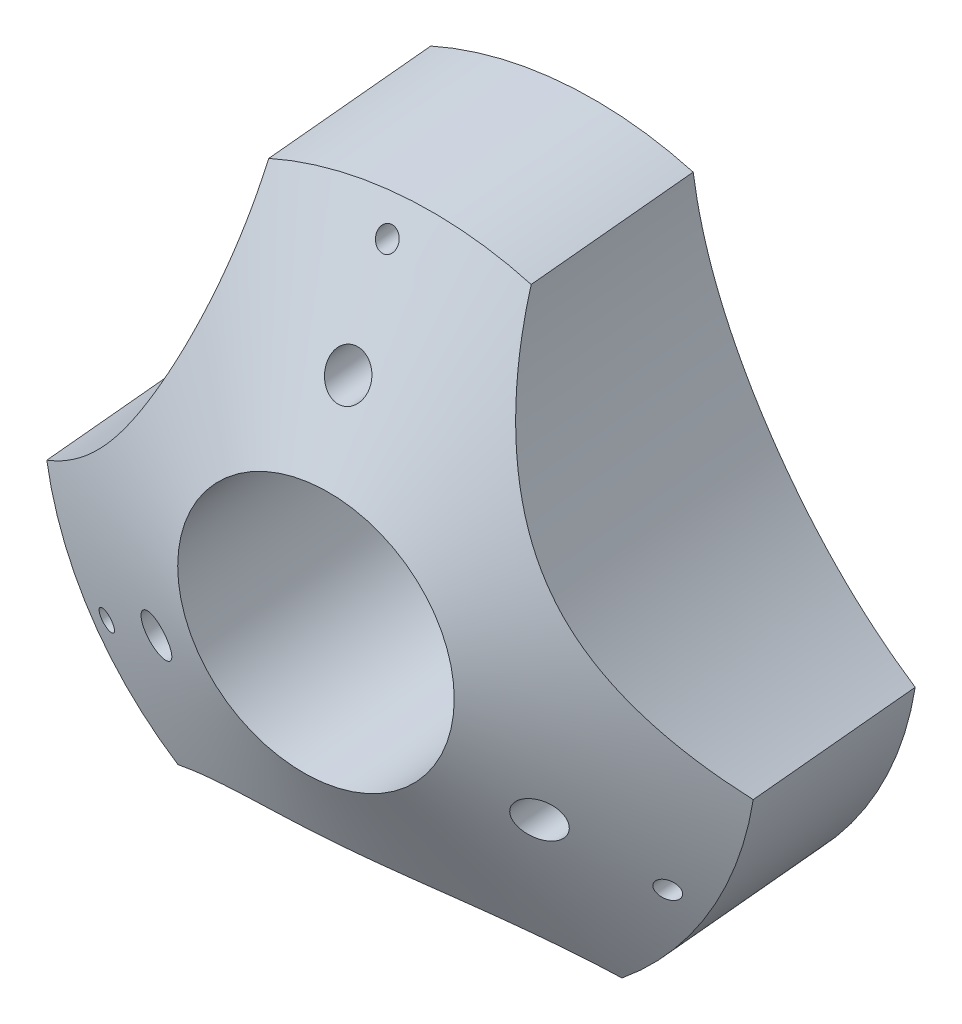
from build123d import *

# Parameters (mm, degrees)
SKETCH_2_R          = 0.9999999999999983
SKETCH_2_R_2        = 44.50000000000001
SKETCH_2_R_3        = 44.49999999999999
SKETCH_2_R_4        = 44.5
SKETCH_2_R_5        = 1.9999999999999967
SKETCH_2_R_6        = 1.9999999999999962
SKETCH_2_R_7        = 2.0000000000000027
SKETCH_2_R_8        = 10.649999999999999
CUT_EXTRUDE_1_DEPTH = 63
FILLET_1_R          = 3
SKETCH_4_R          = 12.500000000000002
CUT_EXTRUDE_2_DEPTH = 32.00000000000001
FILLET_2_R          = 1.5
SHELL_1_T           = 2


with BuildPart() as part:
    # 草图1 → 旋转1 (revolve)
    with BuildSketch(Plane(origin=(0, 0, 0), x_dir=(1, 0, 0), z_dir=(0, 1, 0))):
        Polygon((-51.59278787206553, -29.7871098916836), (-30.342636989002127, -17.51832958971064), (-31.94551618156538, 0), (-54.318226870542745, 0), align=None)
    revolve(axis=Axis((-61.13070942812425, 0, 35.293831455811485), (-0.0911166540680925, 0, -0.995840225815083)))

    # 草图2 → 切除-拉伸1 (cut)
    with BuildSketch(Plane(origin=(-0.4509632083554732, -1e-16, -4.928707137417499), x_dir=(-0.995840225815083, 0, 0.09111665406809252), z_dir=(-0.09111665406809252, 0, -0.995840225815083))):
        with Locations((64.09227531263623, 29.279645264606778)):
            Circle(SKETCH_2_R)
        with Locations((7.800624066647733, 32.50000000000006)):
            Circle(SKETCH_2_R_2)
        with Locations((120.38392655862474, 32.49999999999996)):
            Circle(SKETCH_2_R_3)
        with Locations((89.44919192558241, -14.639822632303394)):
            Circle(SKETCH_2_R)
        with Locations((64.09227531263615, -64.99999999999999)):
            Circle(SKETCH_2_R_4)
        with Locations((38.73535869968999, -14.639822632303373)):
            Circle(SKETCH_2_R)
        with Locations((64.09227531263623, 20)):
            Circle(SKETCH_2_R_5)
        with Locations((81.41278338832497, -10.000000000000002)):
            Circle(SKETCH_2_R_6)
        with Locations((46.77176723694745, -9.999999999999973)):
            Circle(SKETCH_2_R_7)
        with Locations((64.09227531263622, 2e-17)):
            Circle(SKETCH_2_R_8)
    extrude(amount=-CUT_EXTRUDE_1_DEPTH, mode=Mode.SUBTRACT)

    # 圆角1
    fillet_1_edges = [part.edges().sort_by_distance(p)[0] for p in [
        (-64.27121012785221, 10.649999999999999, 0.9703923658251812),
    ]]
    fillet(fillet_1_edges, radius=FILLET_1_R)

    # 草图4 → 切除-拉伸2 (cut)
    with BuildSketch(Plane(origin=(2.2471445444857685, 0, 24.559691677742045), x_dir=(0.995840225815083, 0, -0.09111665406809283), z_dir=(0.09111665406809283, 0, 0.9958402258150831))):
        with Locations((-64.09227531263623, 0)):
            Circle(SKETCH_4_R)
    extrude(amount=-CUT_EXTRUDE_2_DEPTH, mode=Mode.SUBTRACT)

    # 圆角2
    fillet_2_edges = [part.edges().sort_by_distance(p)[0] for p in [
        (-64.22418039431868, -12.499999979298822, 1.4843938714725837),
    ]]
    fillet(fillet_2_edges, radius=FILLET_2_R)

    # 抽壳1 (no face opened: a closed hollow body)
    add(offset(amount=-SHELL_1_T, mode=Mode.PRIVATE), mode=Mode.SUBTRACT)


solid = part.part
